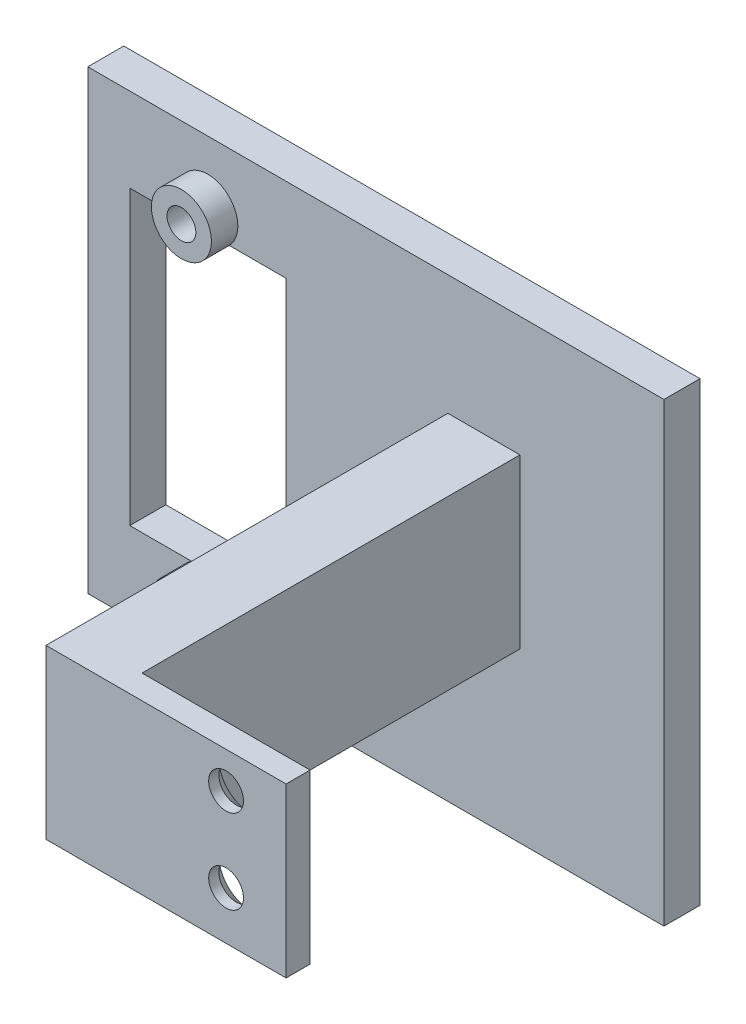
from build123d import *

# Parameters (mm, degrees)
SERVO_SHELF_START                        = -36.480025
SKETCH1_W                                = 48
SKETCH1_H                                = 38
SKETCH1_W_2                              = 13
SKETCH1_H_2                              = 24.35
SERVO_SHELF_DEPTH                        = 3
OUTBOARD_RISER_START                     = -34.480025
SKETCH2_W                                = 6
SKETCH2_H                                = 14
OUTBOARD_RISER_DEPTH                     = 33.480025
PLATE_ATTACHMENT_FOOT_START              = -2
SKETCH3_W                                = 20
SKETCH3_H                                = 14
PLATE_ATTACHMENT_FOOT_DEPTH              = 2
SKETCH4_R                                = 1.45
SERVO_PAD_D2P9_DEPTH                     = 2.01
SKETCH5_R                                = 2.6
SERVO_PAD_CSK_D5P2_90DEG_DEPTH           = 1.15
SERVO_PAD_CSK_D5P2_90DEG_DRAFT           = -45
SERVO_PAD_CSK_D5P2_90DEG_PROFILE_2_DEPTH = 1.15
SERVO_PAD_CSK_D5P2_90DEG_PROFILE_2_DRAFT = -45
SERVO_EAR_SUPPORTS_H2P2_START            = -33.480025
SKETCH6_R                                = 2.5
SERVO_EAR_SUPPORTS_H2P2_DEPTH            = 2.2
SKETCH7_R                                = 1.2
SERVO_EAR_D2P4_THROUGH_DEPTH             = 5.21


with BuildPart() as part:
    # Sketch1 → Servo_Shelf (new body)
    with BuildSketch(Plane.XY.offset(SERVO_SHELF_START)):
        with Locations((-46, 19)):
            Rectangle(SKETCH1_W, SKETCH1_H)
        with Locations((-60, 18.825)):
            Rectangle(SKETCH1_W_2, SKETCH1_H_2, mode=Mode.SUBTRACT)
    extrude(amount=SERVO_SHELF_DEPTH)

    # Sketch2 → Outboard_Riser (add)
    with BuildSketch(Plane.XY.offset(OUTBOARD_RISER_START)):
        with Locations((-37, 21)):
            Rectangle(SKETCH2_W, SKETCH2_H)
    extrude(amount=OUTBOARD_RISER_DEPTH)

    # Sketch3 → Plate_Attachment_Foot (add)
    with BuildSketch(Plane.XY.offset(PLATE_ATTACHMENT_FOOT_START)):
        with Locations((-30, 21)):
            Rectangle(SKETCH3_W, SKETCH3_H)
    extrude(amount=PLATE_ATTACHMENT_FOOT_DEPTH)

    # Sketch4 → Servo_Pad_D2p9 (cut)
    with BuildSketch(Plane(origin=(0, 0, -2), x_dir=(-1, 0, 0), z_dir=(0, 0, -1))):
        with Locations((25, 18)):
            Circle(SKETCH4_R)
        with Locations((25, 25)):
            Circle(SKETCH4_R)
    extrude(amount=-SERVO_PAD_D2P9_DEPTH, mode=Mode.SUBTRACT)


with BuildPart() as servo_pad_csk_d5p2_90deg_tool:
    # Sketch5 → Servo_Pad_CSK_D5p2_90deg (with draft: the straight prism first)
    with BuildSketch(Plane(origin=(0, 0, -2), x_dir=(-1, 0, 0), z_dir=(0, 0, -1))):
        with Locations((25, 18)):
            Circle(SKETCH5_R)
    extrude(amount=-SERVO_PAD_CSK_D5P2_90DEG_DEPTH)
    # Servo_Pad_CSK_D5p2_90deg: the draft: its side faces are tilted about the plane it starts from
    servo_pad_csk_d5p2_90deg_sides = [servo_pad_csk_d5p2_90deg_tool.faces().sort_by_distance(p)[0] for p in [
        (-22.4, 18, -1.425),
    ]]
    draft(servo_pad_csk_d5p2_90deg_sides, Plane(origin=(0, 0, -2), x_dir=(-1, 0, 0), z_dir=(0, 0, -1)), SERVO_PAD_CSK_D5P2_90DEG_DRAFT)


with BuildPart() as part_1:
    add(part.part)

    # Servo_Pad_CSK_D5p2_90deg: cut by servo_pad_csk_d5p2_90deg_tool
    add(servo_pad_csk_d5p2_90deg_tool.part, mode=Mode.SUBTRACT)


with BuildPart() as servo_pad_csk_d5p2_90deg_profile_2_tool:
    # Sketch5 → Servo_Pad_CSK_D5p2_90deg profile 2 (with draft: the straight prism first)
    with BuildSketch(Plane(origin=(0, 0, -2), x_dir=(-1, 0, 0), z_dir=(0, 0, -1))):
        with Locations((25, 25)):
            Circle(SKETCH5_R)
    extrude(amount=-SERVO_PAD_CSK_D5P2_90DEG_PROFILE_2_DEPTH)
    # Servo_Pad_CSK_D5p2_90deg profile 2: the draft: its side faces are tilted about the plane it starts from
    servo_pad_csk_d5p2_90deg_profile_2_sides = [servo_pad_csk_d5p2_90deg_profile_2_tool.faces().sort_by_distance(p)[0] for p in [
        (-22.4, 25, -1.425),
    ]]
    draft(servo_pad_csk_d5p2_90deg_profile_2_sides, Plane(origin=(0, 0, -2), x_dir=(-1, 0, 0), z_dir=(0, 0, -1)), SERVO_PAD_CSK_D5P2_90DEG_PROFILE_2_DRAFT)


with BuildPart() as part_2:
    add(part_1.part)

    # Servo_Pad_CSK_D5p2_90deg profile 2: cut by servo_pad_csk_d5p2_90deg_profile_2_tool
    add(servo_pad_csk_d5p2_90deg_profile_2_tool.part, mode=Mode.SUBTRACT)

    # Sketch6 → Servo_Ear_Supports_H2p2 (add)
    with BuildSketch(Plane.XY.offset(SERVO_EAR_SUPPORTS_H2P2_START)):
        with Locations((-60, 4.55)):
            Circle(SKETCH6_R)
        with Locations((-60, 32.75)):
            Circle(SKETCH6_R)
    extrude(amount=SERVO_EAR_SUPPORTS_H2P2_DEPTH)

    # Sketch7 → Servo_Ear_D2p4_Through (cut)
    with BuildSketch(Plane.XY.offset(-31.280025)):
        with Locations((-60, 4.55)):
            Circle(SKETCH7_R)
        with Locations((-60, 32.75)):
            Circle(SKETCH7_R)
    extrude(amount=-SERVO_EAR_D2P4_THROUGH_DEPTH, mode=Mode.SUBTRACT)


solid = part_2.part
